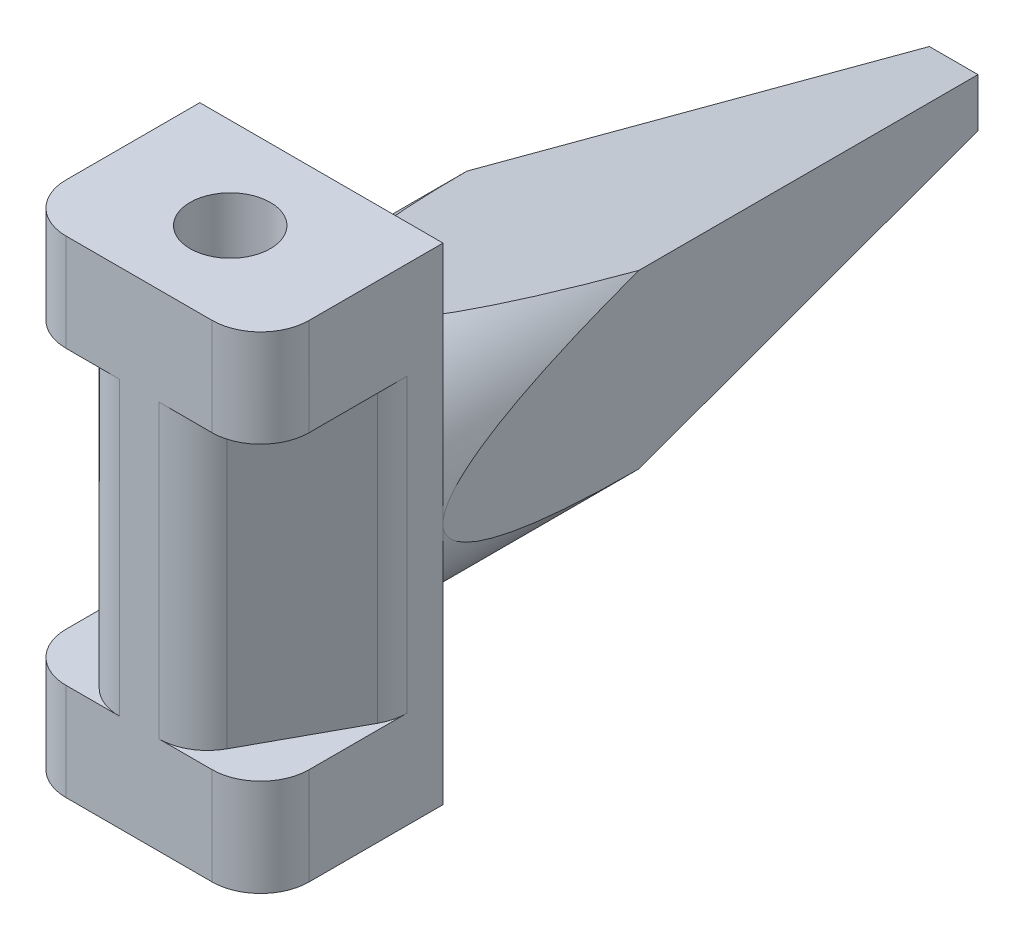
from build123d import *

# Parameters (mm, degrees)
SKETCH1_R           = 1.65
BOSS_EXTRUDE1_DEPTH = 12
BOSS_EXTRUDE2_START = 4
SKETCH2_W           = 10
SKETCH2_H           = 7.5
SKETCH2_R           = 1.65
BOSS_EXTRUDE2_DEPTH = 4
SKETCH3_W           = 10
SKETCH3_H           = 7.5
SKETCH3_R           = 1.65
BOSS_EXTRUDE3_DEPTH = 4
SKETCH4_R           = 5
BOSS_EXTRUDE4_DEPTH = 26
CUT_EXTRUDE1_DEPTH  = 39.448016854
CUT_EXTRUDE2_DEPTH  = 41.277164746
VARFILLET1_R        = 2


with BuildPart() as part:
    # Sketch1 → Boss-Extrude1 (new body)
    with BuildSketch(Plane(origin=(0, 0, 0), x_dir=(1, 0, 0), z_dir=(0, 1, 0))):
        with BuildLine():
            Line((-10, 7.5), (-10, 6.009988029))
            ThreePointArc((-10, 6.009988029), (-9.937986364, 5.515813106), (-9.755791146, 5.052283767))
            Line((-9.755791146, 5.052283767), (-7.568524948, 1.042295739))
            ThreePointArc((-7.568524948, 1.042295739), (-6.833662663, 0.280202261), (-5.812733803, 0))
            Line((-5.812733803, 0), (-4.187266197, 0))
            ThreePointArc((-4.187266197, 0), (-3.166337337, 0.280202261), (-2.431475052, 1.042295739))
            Line((-2.431475052, 1.042295739), (-0.244208854, 5.052283767))
            ThreePointArc((-0.244208854, 5.052283767), (-0.062013636, 5.515813106), (0, 6.009988029))
            Line((0, 6.009988029), (0, 7.5))
            Line((0, 7.5), (-10, 7.5))
        make_face()
        with Locations((-5, 3.75)):
            Circle(SKETCH1_R, mode=Mode.SUBTRACT)
    extrude(amount=BOSS_EXTRUDE1_DEPTH)

    # Sketch2 → Boss-Extrude2 (add)
    with BuildSketch(Plane.XZ.offset(BOSS_EXTRUDE2_START)):
        with Locations((-5, -3.75)):
            Rectangle(SKETCH2_W, SKETCH2_H)
        with Locations((-5, -3.75)):
            Circle(SKETCH2_R, mode=Mode.SUBTRACT)
    extrude(amount=-BOSS_EXTRUDE2_DEPTH)

    # Sketch3 → Boss-Extrude3 (add)
    with BuildSketch(Plane(origin=(0, 12, 0), x_dir=(1, 0, 0), z_dir=(0, 1, 0))):
        with Locations((-5, 3.75)):
            Rectangle(SKETCH3_W, SKETCH3_H)
        with Locations((-5, 3.75)):
            Circle(SKETCH3_R, mode=Mode.SUBTRACT)
    extrude(amount=BOSS_EXTRUDE3_DEPTH)

    # Sketch4 → Boss-Extrude4 (add)
    with BuildSketch(Plane(origin=(0, 0, -7.5), x_dir=(-1, 0, 0), z_dir=(0, 0, -1))):
        with Locations((5, 6)):
            Circle(SKETCH4_R)
    extrude(amount=BOSS_EXTRUDE4_DEPTH)

    # Sketch5 → Cut-Extrude1 (cut, through all)
    with BuildSketch(Plane(origin=(0, 0, 0), x_dir=(0, 0, -1), z_dir=(1, 0, 0))):
        Polygon((33.5, 11), (7.5, 11), (33.5, 7), align=None)
        Polygon((33.5, 1), (33.5, 5), (7.5, 1), align=None)
    extrude(amount=-CUT_EXTRUDE1_DEPTH, mode=Mode.SUBTRACT)

    # Sketch6 → Cut-Extrude2 (cut, through all)
    with BuildSketch(Plane(origin=(0, -4, 0), x_dir=(-1, 0, 0), z_dir=(0, -1, 0))):
        Polygon((0, 7.5), (4, 33.5), (0, 33.5), align=None)
        Polygon((10, 33.5), (6, 33.5), (10, 7.5), align=None)
    extrude(amount=-CUT_EXTRUDE2_DEPTH, mode=Mode.SUBTRACT)

    # VarFillet1
    varfillet1_edges = [part.edges().sort_by_distance(p)[0] for p in [
        (0, 14, 0),
        (-10, 14, 0),
        (-10, -2, 0),
        (0, -2, 0),
    ]]
    fillet(varfillet1_edges, radius=VARFILLET1_R)


solid = part.part
